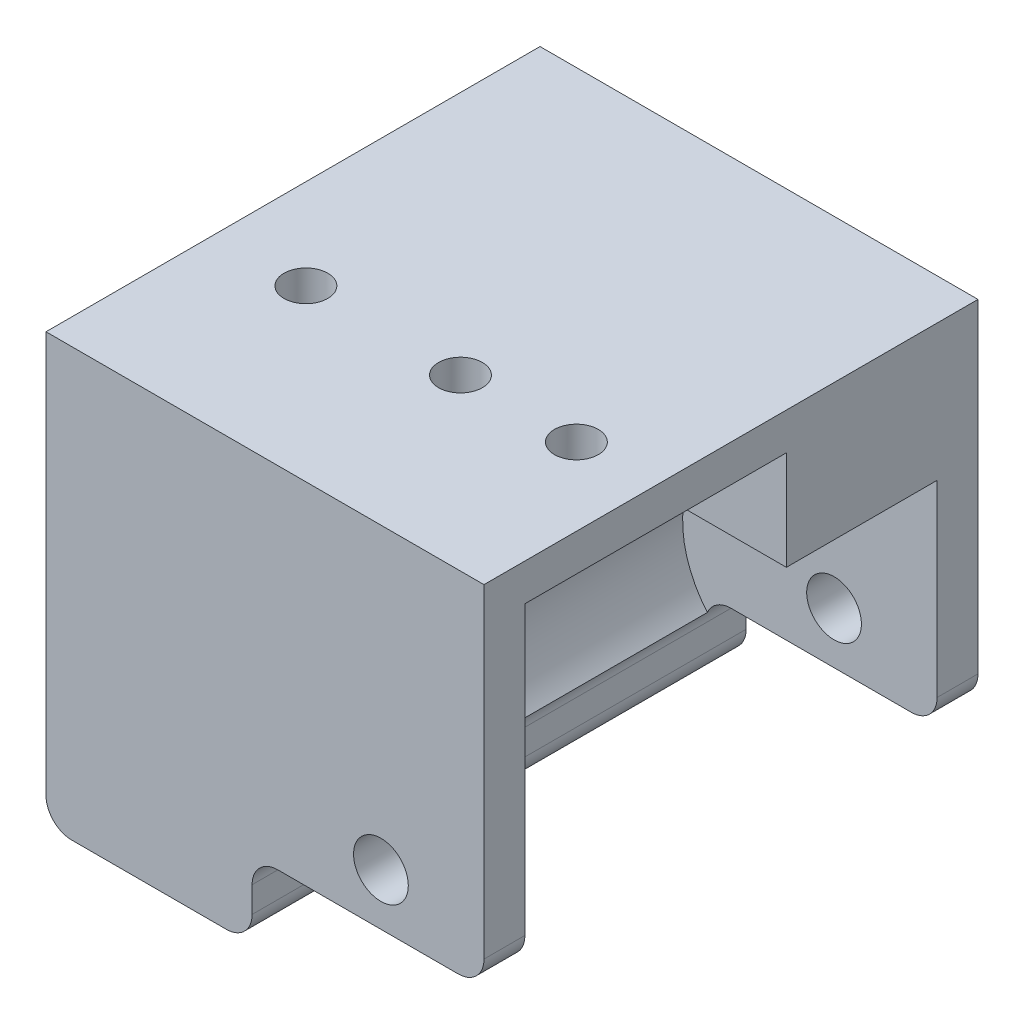
from build123d import *

# Parameters (mm, degrees)
SKETCH1_R           = 2.125
BOSS_EXTRUDE1_DEPTH = 3.175
SKETCH4_W           = 34
SKETCH4_H           = 38.35
BOSS_EXTRUDE2_DEPTH = 3.175
BOSS_EXTRUDE3_REACH = 57.962
SKETCH6_W           = 34
SKETCH6_H           = 7.4
BOSS_EXTRUDE4_DEPTH = 11.7
FILLET1_START       = -36
FILLET1_DEPTH       = 40
FILLET1_START_2     = -35.175
FILLET1_2_DEPTH     = 3.175
FILLET1_3_DEPTH     = 3.175
FILLET1_START_3     = -32.3353435
FILLET1_4_DEPTH     = 32.635
SKETCH7_W           = 34
SKETCH7_H           = 20.3
CUT_EXTRUDE1_DEPTH  = 0.3
SKETCH8_R           = 1.7
CUT_EXTRUDE2_DEPTH  = 60.108893155


with BuildPart() as part:
    # Sketch1 → Boss-Extrude1 (new body)
    with BuildSketch(Plane.XY):
        Polygon((0, 0), (-18, 0), (-18, -6), (-34, -6), (-34, 0), (-34, 24), (0, 24), align=None)
        with Locations((-8, 4)):
            Circle(SKETCH1_R, mode=Mode.SUBTRACT)
    boss_extrude1 = extrude(amount=BOSS_EXTRUDE1_DEPTH)

    # Sketch4 → Boss-Extrude2 (add)
    with BuildSketch(Plane(origin=(0, 24, 0), x_dir=(1, 0, 0), z_dir=(0, 1, 0))):
        with Locations((-17, 16)):
            Rectangle(SKETCH4_W, SKETCH4_H)
    extrude(amount=BOSS_EXTRUDE2_DEPTH)

    # Mirror2: Boss-Extrude1 across plane
    add(boss_extrude1.mirror(Plane(origin=(0, 0, -16), x_dir=(1, 0, 0), z_dir=(0, 0, -1))))

    # Sketch5 → Boss-Extrude3 (add, up to next)
    with BuildSketch(Plane(origin=(0, 0, 0), x_dir=(-1, 0, 0), z_dir=(0, 0, -1)), mode=Mode.PRIVATE) as boss_extrude3_sk1:
        with BuildLine():
            Line((18, 9), (18, 16.6))
            Line((18, 16.6), (34, 16.6))
            Line((34, 16.6), (34, -6))
            Line((34, -6), (18, -6))
            Line((18, -6), (18, -1))
            ThreePointArc((18, -1), (19.755002002, 4), (18, 9))
        make_face()
    boss_extrude3_tool1 = extrude(boss_extrude3_sk1.sketch, amount=BOSS_EXTRUDE3_REACH, mode=Mode.PRIVATE) - part.part
    add(boss_extrude3_tool1.solids().sort_by_distance((-26.249904, 5.344559, 0))[0])

    # Sketch6 → Boss-Extrude4 (add)
    with BuildSketch(Plane.XY.offset(-32)):
        with Locations((-17, 20.3)):
            Rectangle(SKETCH6_W, SKETCH6_H)
    extrude(amount=BOSS_EXTRUDE4_DEPTH)

    # Fillet1: read off the stored shape, not the designer's step
    # Fillet1 outline → Fillet1 (cut)
    with BuildSketch(Plane.XY.offset(FILLET1_START)):
        with BuildLine():
            Line((-34, -6), (-32, -6))
            ThreePointArc((-32, -6), (-33.414213562, -5.414213562), (-34, -4))
            Line((-34, -4), (-34, -6))
        make_face()
        with BuildLine():
            Line((-18, -6), (-18, -4))
            ThreePointArc((-18, -4), (-18.585786438, -5.414213562), (-20, -6))
            Line((-20, -6), (-18, -6))
        make_face()
        with BuildLine():
            ThreePointArc((0, 2), (-0.585786438, 0.585786438), (-2, 0))
            Line((-2, 0), (0, 0))
            Line((0, 0), (0, 2))
        make_face()
    extrude(amount=FILLET1_DEPTH, mode=Mode.SUBTRACT)

    # Fillet1 2 outline → Fillet1 2 (add)
    with BuildSketch(Plane.XY.offset(FILLET1_START_2)):
        with BuildLine():
            Line((-16, 0), (-18, 0))
            Line((-18, 0), (-18, -2))
            ThreePointArc((-18, -2), (-17.414213562, -0.585786438), (-16, 0))
        make_face()
    extrude(amount=FILLET1_2_DEPTH)

    # Fillet1 3 outline → Fillet1 3 (add)
    with BuildSketch(Plane.XY):
        with BuildLine():
            Line((-16, 0), (-18, 0))
            Line((-18, 0), (-18, -2))
            ThreePointArc((-18, -2), (-17.414213562, -0.585786438), (-16, 0))
        make_face()
    extrude(amount=FILLET1_3_DEPTH)

    # Fillet1 4 outline → Fillet1 4 (add)
    with BuildSketch(Plane.XY.offset(FILLET1_START_3)):
        with BuildLine():
            ThreePointArc((-18, -2), (-17.957937252, -1.591978289), (-17.833518283, -1.201119092))
            ThreePointArc((-17.833518283, -1.201119092), (-17.91757965, -1.101238744), (-18, -1))
            Line((-18, -1), (-18, -2))
        make_face()
    extrude(amount=FILLET1_4_DEPTH)

    # Sketch7 → Cut-Extrude1 (cut)
    with BuildSketch(Plane.XZ.offset(-24)):
        with Locations((-17, -10.15)):
            Rectangle(SKETCH7_W, SKETCH7_H)
    extrude(amount=-CUT_EXTRUDE1_DEPTH, mode=Mode.SUBTRACT)

    # Sketch8 → Cut-Extrude2 (cut, through all)
    with BuildSketch(Plane(origin=(0, 27.175, 0), x_dir=(1, 0, 0), z_dir=(0, 1, 0))):
        with Locations(Location((-15, 10, 0), (0, 0, 180))):
            Circle(SKETCH8_R)
        with Locations(Location((-27, 10, 0), (0, 0, 180))):
            Circle(SKETCH8_R)
        with Locations(Location((-6, 10, 0), (0, 0, 180))):
            Circle(SKETCH8_R)
    extrude(amount=-CUT_EXTRUDE2_DEPTH, mode=Mode.SUBTRACT)


solid = part.part
